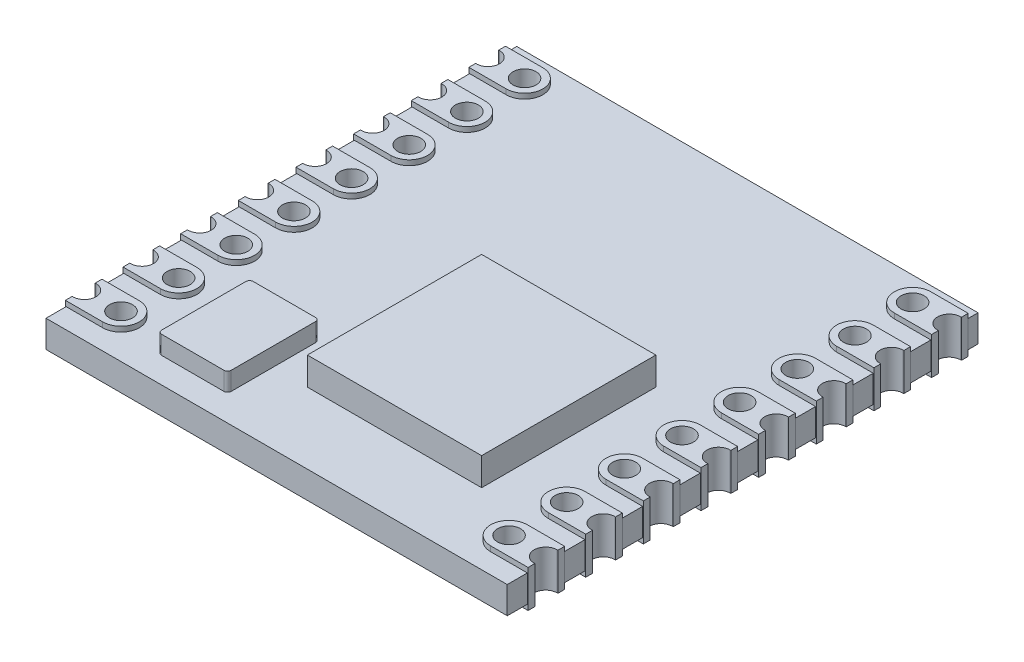
from build123d import *
from build123d.topology import SkipClean

# Parameters (mm, degrees)
SKETCH1_W             = 16.002
SKETCH1_H             = 16.3322
BOSS_EXTRUDE1_DEPTH   = 0.9398
BOSS_EXTRUDE2_DEPTH   = 0.1778
SKETCH2_R             = 0.399999962
CUT_EXTRUDE1_DEPTH    = 12.505618252
SKETCH4_W             = 0.235000038
SKETCH4_H             = 1.2954
BOSS_EXTRUDE3_DEPTH   = 0.0254
LPATTERN1_OUTLINE_R   = 0.399999962
LPATTERN1_DEPTH       = 0.9398
LPATTERN1_START       = -0.1778
LPATTERN1_2_OUTLINE_R = 0.399999962
LPATTERN1_2_DEPTH     = 1.2954
MIRROR2_OUTLINE_R     = 0.399999962
MIRROR2_DEPTH         = 0.9398
MIRROR2_START         = -0.1778
MIRROR2_2_OUTLINE_R   = 0.399999962
MIRROR2_2_DEPTH       = 1.2954
SKETCH5_W             = 6.0452
SKETCH5_H             = 6.0452
BOSS_EXTRUDE4_DEPTH   = 0.9652
SKETCH6_W             = 2.413
SKETCH6_H             = 3.175
BOSS_EXTRUDE5_DEPTH   = 0.635
FILLET1_R             = 0.127


# Read off the part's stored shape, not the designer's step: LPattern1, Mirror2
with BuildPart() as part:
    # Sketch1 → Boss-Extrude1 (new body)
    with BuildSketch(Plane(origin=(0, 0, 0), x_dir=(1, 0, 0), z_dir=(0, 1, 0))):
        Rectangle(SKETCH1_W, SKETCH1_H)
    extrude(amount=BOSS_EXTRUDE1_DEPTH)

    # Sketch3 → Boss-Extrude2 (add)
    with BuildSketch(Plane(origin=(0, 0.9398, 0), x_dir=(1, 0, 0), z_dir=(0, 1, 0))):
        with BuildLine():
            Line((-6.731, 7.8011), (-8.001, 7.8011))
            Line((-8.001, 7.8011), (-8.001, 6.5311))
            Line((-8.001, 6.5311), (-6.731, 6.5311))
            ThreePointArc((-6.731, 6.5311), (-6.096, 7.1661), (-6.731, 7.8011))
        make_face()
    boss_extrude2 = extrude(amount=BOSS_EXTRUDE2_DEPTH)

    # Mirror1: Boss-Extrude2 across plane
    add(boss_extrude2.mirror(Plane(origin=(0, 0.4699, 0), x_dir=(0, 0, 1), z_dir=(0, -1, 0))))

    # Sketch2 → Cut-Extrude1 (cut, through all)
    with BuildSketch(Plane(origin=(0, 1.1176, 0), x_dir=(1, 0, 0), z_dir=(0, 1, 0))):
        with Locations(Location((-6.731, 7.1661, 0), (0, 0, 270))):
            Circle(SKETCH2_R)
        with BuildLine():
            Line((-8.001, 7.566099962), (-8.001, 6.766100038))
            ThreePointArc((-8.001, 6.766100038), (-7.601000038, 7.1661), (-8.001, 7.566099962))
        make_face()
    extrude(amount=-CUT_EXTRUDE1_DEPTH, mode=Mode.SUBTRACT)

    # Sketch4 → Boss-Extrude3 (add)
    with BuildSketch(Plane.ZY.offset(8.001)):
        with Locations((-7.683599981, 0.4699)):
            Rectangle(SKETCH4_W, SKETCH4_H)
        with Locations((-6.648600019, 0.4699)):
            Rectangle(SKETCH4_W, SKETCH4_H)
    extrude(amount=BOSS_EXTRUDE3_DEPTH)

    # LPattern1 outline → LPattern1 (cut)
    with BuildSketch(Plane(origin=(0, 0, 0), x_dir=(1, 0, 0), z_dir=(0, 1, 0))):
        with BuildLine():
            ThreePointArc((-8.001, 4.766100038), (-7.601000038, 5.1661), (-8.001, 5.566099962))
            Line((-8.001, 5.566099962), (-8.001, 4.766100038))
        make_face()
        with BuildLine():
            ThreePointArc((-8.001, 2.766100038), (-7.601000038, 3.1661), (-8.001, 3.566099962))
            Line((-8.001, 3.566099962), (-8.001, 2.766100038))
        make_face()
        with BuildLine():
            ThreePointArc((-8.001, 0.766100038), (-7.601000038, 1.1661), (-8.001, 1.566099962))
            Line((-8.001, 1.566099962), (-8.001, 0.766100038))
        make_face()
        with BuildLine():
            ThreePointArc((-8.001, -1.233899962), (-7.601000038, -0.8339), (-8.001, -0.433900038))
            Line((-8.001, -0.433900038), (-8.001, -1.233899962))
        make_face()
        with BuildLine():
            ThreePointArc((-8.001, -3.233899962), (-7.601000038, -2.8339), (-8.001, -2.433900038))
            Line((-8.001, -2.433900038), (-8.001, -3.233899962))
        make_face()
        with BuildLine():
            ThreePointArc((-8.001, -5.233899962), (-7.601000038, -4.8339), (-8.001, -4.433900038))
            Line((-8.001, -4.433900038), (-8.001, -5.233899962))
        make_face()
        with BuildLine():
            ThreePointArc((-8.001, -7.233899962), (-7.601000038, -6.8339), (-8.001, -6.433900038))
            Line((-8.001, -6.433900038), (-8.001, -7.233899962))
        make_face()
        with Locations((-6.731, 5.1661)):
            Circle(LPATTERN1_OUTLINE_R)
        with Locations((-6.731, 3.1661)):
            Circle(LPATTERN1_OUTLINE_R)
        with Locations((-6.731, 1.1661)):
            Circle(LPATTERN1_OUTLINE_R)
        with Locations((-6.731, -0.8339)):
            Circle(LPATTERN1_OUTLINE_R)
        with Locations((-6.731, -2.8339)):
            Circle(LPATTERN1_OUTLINE_R)
        with Locations((-6.731, -4.8339)):
            Circle(LPATTERN1_OUTLINE_R)
        with Locations((-6.731, -6.8339)):
            Circle(LPATTERN1_OUTLINE_R)
    extrude(amount=LPATTERN1_DEPTH, mode=Mode.SUBTRACT)

    # LPattern1 2 outline → LPattern1 2 (add)
    # profile 1 of 7: a face of its own
    with SkipClean():  # the faces are left unmerged after this step: merging them gives an invalid solid
        with BuildSketch(Plane(origin=(0, 0, 0), x_dir=(1, 0, 0), z_dir=(0, 1, 0)).offset(LPATTERN1_START)):
            with BuildLine():
                Line((-8.0264, 5.8011), (-8.0264, 5.566099962))
                Line((-8.0264, 5.566099962), (-8.001, 5.566099962))
                ThreePointArc((-8.001, 5.566099962), (-7.601000038, 5.1661), (-8.001, 4.766100038))
                Line((-8.001, 4.766100038), (-8.0264, 4.766100038))
                Line((-8.0264, 4.766100038), (-8.0264, 4.5311))
                Line((-8.0264, 4.5311), (-6.731, 4.5311))
                ThreePointArc((-6.731, 4.5311), (-6.096, 5.1661), (-6.731, 5.8011))
                Line((-6.731, 5.8011), (-8.0264, 5.8011))
            make_face()
            with Locations((-6.731, 5.1661)):
                Circle(LPATTERN1_2_OUTLINE_R, mode=Mode.SUBTRACT)
        # profile 2 of 7: a face of its own
        with BuildSketch(Plane(origin=(0, 0, 0), x_dir=(1, 0, 0), z_dir=(0, 1, 0)).offset(LPATTERN1_START)):
            with BuildLine():
                Line((-6.731, -6.1989), (-8.0264, -6.1989))
                Line((-8.0264, -6.1989), (-8.0264, -6.433900038))
                Line((-8.0264, -6.433900038), (-8.001, -6.433900038))
                ThreePointArc((-8.001, -6.433900038), (-7.601000038, -6.8339), (-8.001, -7.233899962))
                Line((-8.001, -7.233899962), (-8.0264, -7.233899962))
                Line((-8.0264, -7.233899962), (-8.0264, -7.4689))
                Line((-8.0264, -7.4689), (-6.731, -7.4689))
                ThreePointArc((-6.731, -7.4689), (-6.096, -6.8339), (-6.731, -6.1989))
            make_face()
            with Locations((-6.731, -6.8339)):
                Circle(LPATTERN1_2_OUTLINE_R, mode=Mode.SUBTRACT)
        # profile 3 of 7: a face of its own
        with BuildSketch(Plane(origin=(0, 0, 0), x_dir=(1, 0, 0), z_dir=(0, 1, 0)).offset(LPATTERN1_START)):
            with BuildLine():
                Line((-6.731, -4.1989), (-8.0264, -4.1989))
                Line((-8.0264, -4.1989), (-8.0264, -4.433900038))
                Line((-8.0264, -4.433900038), (-8.001, -4.433900038))
                ThreePointArc((-8.001, -4.433900038), (-7.601000038, -4.8339), (-8.001, -5.233899962))
                Line((-8.001, -5.233899962), (-8.0264, -5.233899962))
                Line((-8.0264, -5.233899962), (-8.0264, -5.4689))
                Line((-8.0264, -5.4689), (-6.731, -5.4689))
                ThreePointArc((-6.731, -5.4689), (-6.096, -4.8339), (-6.731, -4.1989))
            make_face()
            with Locations((-6.731, -4.8339)):
                Circle(LPATTERN1_2_OUTLINE_R, mode=Mode.SUBTRACT)
        # profile 4 of 7: a face of its own
        with BuildSketch(Plane(origin=(0, 0, 0), x_dir=(1, 0, 0), z_dir=(0, 1, 0)).offset(LPATTERN1_START)):
            with BuildLine():
                Line((-6.731, -2.1989), (-8.0264, -2.1989))
                Line((-8.0264, -2.1989), (-8.0264, -2.433900038))
                Line((-8.0264, -2.433900038), (-8.001, -2.433900038))
                ThreePointArc((-8.001, -2.433900038), (-7.601000038, -2.8339), (-8.001, -3.233899962))
                Line((-8.001, -3.233899962), (-8.0264, -3.233899962))
                Line((-8.0264, -3.233899962), (-8.0264, -3.4689))
                Line((-8.0264, -3.4689), (-6.731, -3.4689))
                ThreePointArc((-6.731, -3.4689), (-6.096, -2.8339), (-6.731, -2.1989))
            make_face()
            with Locations((-6.731, -2.8339)):
                Circle(LPATTERN1_2_OUTLINE_R, mode=Mode.SUBTRACT)
        # profile 5 of 7: a face of its own
        with BuildSketch(Plane(origin=(0, 0, 0), x_dir=(1, 0, 0), z_dir=(0, 1, 0)).offset(LPATTERN1_START)):
            with BuildLine():
                Line((-6.731, -0.1989), (-8.0264, -0.1989))
                Line((-8.0264, -0.1989), (-8.0264, -0.433900038))
                Line((-8.0264, -0.433900038), (-8.001, -0.433900038))
                ThreePointArc((-8.001, -0.433900038), (-7.601000038, -0.8339), (-8.001, -1.233899962))
                Line((-8.001, -1.233899962), (-8.0264, -1.233899962))
                Line((-8.0264, -1.233899962), (-8.0264, -1.4689))
                Line((-8.0264, -1.4689), (-6.731, -1.4689))
                ThreePointArc((-6.731, -1.4689), (-6.096, -0.8339), (-6.731, -0.1989))
            make_face()
            with Locations((-6.731, -0.8339)):
                Circle(LPATTERN1_2_OUTLINE_R, mode=Mode.SUBTRACT)
        # profile 6 of 7: a face of its own
        with BuildSketch(Plane(origin=(0, 0, 0), x_dir=(1, 0, 0), z_dir=(0, 1, 0)).offset(LPATTERN1_START)):
            with BuildLine():
                Line((-6.731, 1.8011), (-8.0264, 1.8011))
                Line((-8.0264, 1.8011), (-8.0264, 1.566099962))
                Line((-8.0264, 1.566099962), (-8.001, 1.566099962))
                ThreePointArc((-8.001, 1.566099962), (-7.601000038, 1.1661), (-8.001, 0.766100038))
                Line((-8.001, 0.766100038), (-8.0264, 0.766100038))
                Line((-8.0264, 0.766100038), (-8.0264, 0.5311))
                Line((-8.0264, 0.5311), (-6.731, 0.5311))
                ThreePointArc((-6.731, 0.5311), (-6.096, 1.1661), (-6.731, 1.8011))
            make_face()
            with Locations((-6.731, 1.1661)):
                Circle(LPATTERN1_2_OUTLINE_R, mode=Mode.SUBTRACT)
        # profile 7 of 7: a face of its own
        with BuildSketch(Plane(origin=(0, 0, 0), x_dir=(1, 0, 0), z_dir=(0, 1, 0)).offset(LPATTERN1_START)):
            with BuildLine():
                Line((-6.731, 3.8011), (-8.0264, 3.8011))
                Line((-8.0264, 3.8011), (-8.0264, 3.566099962))
                Line((-8.0264, 3.566099962), (-8.001, 3.566099962))
                ThreePointArc((-8.001, 3.566099962), (-7.601000038, 3.1661), (-8.001, 2.766100038))
                Line((-8.001, 2.766100038), (-8.0264, 2.766100038))
                Line((-8.0264, 2.766100038), (-8.0264, 2.5311))
                Line((-8.0264, 2.5311), (-6.731, 2.5311))
                ThreePointArc((-6.731, 2.5311), (-6.096, 3.1661), (-6.731, 3.8011))
            make_face()
            with Locations((-6.731, 3.1661)):
                Circle(LPATTERN1_2_OUTLINE_R, mode=Mode.SUBTRACT)
        extrude(amount=LPATTERN1_2_DEPTH)
    add(part.part.scale(1), mode=Mode.REPLACE)  # the faces are merged on a copy

    # Mirror2 outline → Mirror2 (cut)
    with BuildSketch(Plane(origin=(0, 0, 0), x_dir=(1, 0, 0), z_dir=(0, 1, 0))):
        with BuildLine():
            Line((8.001, 6.766100038), (8.001, 7.566099962))
            ThreePointArc((8.001, 7.566099962), (7.601000038, 7.1661), (8.001, 6.766100038))
        make_face()
        with BuildLine():
            Line((8.001, 4.766100038), (8.001, 5.566099962))
            ThreePointArc((8.001, 5.566099962), (7.601000038, 5.1661), (8.001, 4.766100038))
        make_face()
        with BuildLine():
            Line((8.001, 2.766100038), (8.001, 3.566099962))
            ThreePointArc((8.001, 3.566099962), (7.601000038, 3.1661), (8.001, 2.766100038))
        make_face()
        with BuildLine():
            Line((8.001, 0.766100038), (8.001, 1.566099962))
            ThreePointArc((8.001, 1.566099962), (7.601000038, 1.1661), (8.001, 0.766100038))
        make_face()
        with BuildLine():
            Line((8.001, -1.233899962), (8.001, -0.433900038))
            ThreePointArc((8.001, -0.433900038), (7.601000038, -0.8339), (8.001, -1.233899962))
        make_face()
        with BuildLine():
            Line((8.001, -3.233899962), (8.001, -2.433900038))
            ThreePointArc((8.001, -2.433900038), (7.601000038, -2.8339), (8.001, -3.233899962))
        make_face()
        with BuildLine():
            Line((8.001, -5.233899962), (8.001, -4.433900038))
            ThreePointArc((8.001, -4.433900038), (7.601000038, -4.8339), (8.001, -5.233899962))
        make_face()
        with BuildLine():
            Line((8.001, -7.233899962), (8.001, -6.433900038))
            ThreePointArc((8.001, -6.433900038), (7.601000038, -6.8339), (8.001, -7.233899962))
        make_face()
        with Locations((6.731, 7.1661)):
            Circle(MIRROR2_OUTLINE_R)
        with Locations((6.731, 5.1661)):
            Circle(MIRROR2_OUTLINE_R)
        with Locations((6.731, 3.1661)):
            Circle(MIRROR2_OUTLINE_R)
        with Locations((6.731, 1.1661)):
            Circle(MIRROR2_OUTLINE_R)
        with Locations((6.731, -0.8339)):
            Circle(MIRROR2_OUTLINE_R)
        with Locations((6.731, -2.8339)):
            Circle(MIRROR2_OUTLINE_R)
        with Locations((6.731, -4.8339)):
            Circle(MIRROR2_OUTLINE_R)
        with Locations((6.731, -6.8339)):
            Circle(MIRROR2_OUTLINE_R)
    extrude(amount=MIRROR2_DEPTH, mode=Mode.SUBTRACT)

    # Mirror2 2 outline → Mirror2 2 (add)
    # profile 1 of 8: a face of its own
    with SkipClean():  # the faces are left unmerged after this step: merging them gives an invalid solid
        with BuildSketch(Plane(origin=(0, 0, 0), x_dir=(1, 0, 0), z_dir=(0, 1, 0)).offset(MIRROR2_START)):
            with BuildLine():
                Line((8.0264, 7.566099962), (8.0264, 7.8011))
                Line((8.0264, 7.8011), (6.731, 7.8011))
                ThreePointArc((6.731, 7.8011), (6.096, 7.1661), (6.731, 6.5311))
                Line((6.731, 6.5311), (8.0264, 6.5311))
                Line((8.0264, 6.5311), (8.0264, 6.766100038))
                Line((8.0264, 6.766100038), (8.001, 6.766100038))
                ThreePointArc((8.001, 6.766100038), (7.601000038, 7.1661), (8.001, 7.566099962))
                Line((8.001, 7.566099962), (8.0264, 7.566099962))
            make_face()
            with Locations((6.731, 7.1661)):
                Circle(MIRROR2_2_OUTLINE_R, mode=Mode.SUBTRACT)
        # profile 2 of 8: a face of its own
        with BuildSketch(Plane(origin=(0, 0, 0), x_dir=(1, 0, 0), z_dir=(0, 1, 0)).offset(MIRROR2_START)):
            with BuildLine():
                Line((8.0264, -6.1989), (6.731, -6.1989))
                ThreePointArc((6.731, -6.1989), (6.096, -6.8339), (6.731, -7.4689))
                Line((6.731, -7.4689), (8.0264, -7.4689))
                Line((8.0264, -7.4689), (8.0264, -7.233899962))
                Line((8.0264, -7.233899962), (8.001, -7.233899962))
                ThreePointArc((8.001, -7.233899962), (7.601000038, -6.8339), (8.001, -6.433900038))
                Line((8.001, -6.433900038), (8.0264, -6.433900038))
                Line((8.0264, -6.433900038), (8.0264, -6.1989))
            make_face()
            with Locations((6.731, -6.8339)):
                Circle(MIRROR2_2_OUTLINE_R, mode=Mode.SUBTRACT)
        # profile 3 of 8: a face of its own
        with BuildSketch(Plane(origin=(0, 0, 0), x_dir=(1, 0, 0), z_dir=(0, 1, 0)).offset(MIRROR2_START)):
            with BuildLine():
                Line((8.0264, -4.1989), (6.731, -4.1989))
                ThreePointArc((6.731, -4.1989), (6.096, -4.8339), (6.731, -5.4689))
                Line((6.731, -5.4689), (8.0264, -5.4689))
                Line((8.0264, -5.4689), (8.0264, -5.233899962))
                Line((8.0264, -5.233899962), (8.001, -5.233899962))
                ThreePointArc((8.001, -5.233899962), (7.601000038, -4.8339), (8.001, -4.433900038))
                Line((8.001, -4.433900038), (8.0264, -4.433900038))
                Line((8.0264, -4.433900038), (8.0264, -4.1989))
            make_face()
            with Locations((6.731, -4.8339)):
                Circle(MIRROR2_2_OUTLINE_R, mode=Mode.SUBTRACT)
        # profile 4 of 8: a face of its own
        with BuildSketch(Plane(origin=(0, 0, 0), x_dir=(1, 0, 0), z_dir=(0, 1, 0)).offset(MIRROR2_START)):
            with BuildLine():
                Line((8.0264, -2.1989), (6.731, -2.1989))
                ThreePointArc((6.731, -2.1989), (6.096, -2.8339), (6.731, -3.4689))
                Line((6.731, -3.4689), (8.0264, -3.4689))
                Line((8.0264, -3.4689), (8.0264, -3.233899962))
                Line((8.0264, -3.233899962), (8.001, -3.233899962))
                ThreePointArc((8.001, -3.233899962), (7.601000038, -2.8339), (8.001, -2.433900038))
                Line((8.001, -2.433900038), (8.0264, -2.433900038))
                Line((8.0264, -2.433900038), (8.0264, -2.1989))
            make_face()
            with Locations((6.731, -2.8339)):
                Circle(MIRROR2_2_OUTLINE_R, mode=Mode.SUBTRACT)
        # profile 5 of 8: a face of its own
        with BuildSketch(Plane(origin=(0, 0, 0), x_dir=(1, 0, 0), z_dir=(0, 1, 0)).offset(MIRROR2_START)):
            with BuildLine():
                Line((8.0264, -0.1989), (6.731, -0.1989))
                ThreePointArc((6.731, -0.1989), (6.096, -0.8339), (6.731, -1.4689))
                Line((6.731, -1.4689), (8.0264, -1.4689))
                Line((8.0264, -1.4689), (8.0264, -1.233899962))
                Line((8.0264, -1.233899962), (8.001, -1.233899962))
                ThreePointArc((8.001, -1.233899962), (7.601000038, -0.8339), (8.001, -0.433900038))
                Line((8.001, -0.433900038), (8.0264, -0.433900038))
                Line((8.0264, -0.433900038), (8.0264, -0.1989))
            make_face()
            with Locations((6.731, -0.8339)):
                Circle(MIRROR2_2_OUTLINE_R, mode=Mode.SUBTRACT)
        # profile 6 of 8: a face of its own
        with BuildSketch(Plane(origin=(0, 0, 0), x_dir=(1, 0, 0), z_dir=(0, 1, 0)).offset(MIRROR2_START)):
            with BuildLine():
                Line((8.0264, 1.8011), (6.731, 1.8011))
                ThreePointArc((6.731, 1.8011), (6.096, 1.1661), (6.731, 0.5311))
                Line((6.731, 0.5311), (8.0264, 0.5311))
                Line((8.0264, 0.5311), (8.0264, 0.766100038))
                Line((8.0264, 0.766100038), (8.001, 0.766100038))
                ThreePointArc((8.001, 0.766100038), (7.601000038, 1.1661), (8.001, 1.566099962))
                Line((8.001, 1.566099962), (8.0264, 1.566099962))
                Line((8.0264, 1.566099962), (8.0264, 1.8011))
            make_face()
            with Locations((6.731, 1.1661)):
                Circle(MIRROR2_2_OUTLINE_R, mode=Mode.SUBTRACT)
        # profile 7 of 8: a face of its own
        with BuildSketch(Plane(origin=(0, 0, 0), x_dir=(1, 0, 0), z_dir=(0, 1, 0)).offset(MIRROR2_START)):
            with BuildLine():
                Line((8.0264, 3.8011), (6.731, 3.8011))
                ThreePointArc((6.731, 3.8011), (6.096, 3.1661), (6.731, 2.5311))
                Line((6.731, 2.5311), (8.0264, 2.5311))
                Line((8.0264, 2.5311), (8.0264, 2.766100038))
                Line((8.0264, 2.766100038), (8.001, 2.766100038))
                ThreePointArc((8.001, 2.766100038), (7.601000038, 3.1661), (8.001, 3.566099962))
                Line((8.001, 3.566099962), (8.0264, 3.566099962))
                Line((8.0264, 3.566099962), (8.0264, 3.8011))
            make_face()
            with Locations((6.731, 3.1661)):
                Circle(MIRROR2_2_OUTLINE_R, mode=Mode.SUBTRACT)
        # profile 8 of 8: a face of its own
        with BuildSketch(Plane(origin=(0, 0, 0), x_dir=(1, 0, 0), z_dir=(0, 1, 0)).offset(MIRROR2_START)):
            with BuildLine():
                Line((8.0264, 5.8011), (6.731, 5.8011))
                ThreePointArc((6.731, 5.8011), (6.096, 5.1661), (6.731, 4.5311))
                Line((6.731, 4.5311), (8.0264, 4.5311))
                Line((8.0264, 4.5311), (8.0264, 4.766100038))
                Line((8.0264, 4.766100038), (8.001, 4.766100038))
                ThreePointArc((8.001, 4.766100038), (7.601000038, 5.1661), (8.001, 5.566099962))
                Line((8.001, 5.566099962), (8.0264, 5.566099962))
                Line((8.0264, 5.566099962), (8.0264, 5.8011))
            make_face()
            with Locations((6.731, 5.1661)):
                Circle(MIRROR2_2_OUTLINE_R, mode=Mode.SUBTRACT)
        extrude(amount=MIRROR2_2_DEPTH)
    add(part.part.scale(1), mode=Mode.REPLACE)  # the faces are merged on a copy

    # Sketch5 → Boss-Extrude4 (add)
    with BuildSketch(Plane(origin=(0, 0.9398, 0), x_dir=(1, 0, 0), z_dir=(0, 1, 0))):
        with Locations((1.6256, -2.6797)):
            Rectangle(SKETCH5_W, SKETCH5_H)
    extrude(amount=BOSS_EXTRUDE4_DEPTH)

    # Sketch6 → Boss-Extrude5 (add)
    with BuildSketch(Plane(origin=(0, 0.9398, 0), x_dir=(1, 0, 0), z_dir=(0, 1, 0))):
        with Locations((-3.7973, -5.6896)):
            Rectangle(SKETCH6_W, SKETCH6_H)
    extrude(amount=BOSS_EXTRUDE5_DEPTH)

    # Fillet1
    fillet1_edges = [part.edges().sort_by_distance(p)[0] for p in [
        (-5.0038, 1.2573, 4.1021),
        (-5.0038, 1.2573, 7.2771),
        (-2.5908, 1.2573, 7.2771),
        (-2.5908, 1.2573, 4.1021),
    ]]
    fillet(fillet1_edges, radius=FILLET1_R)


solid = part.part
